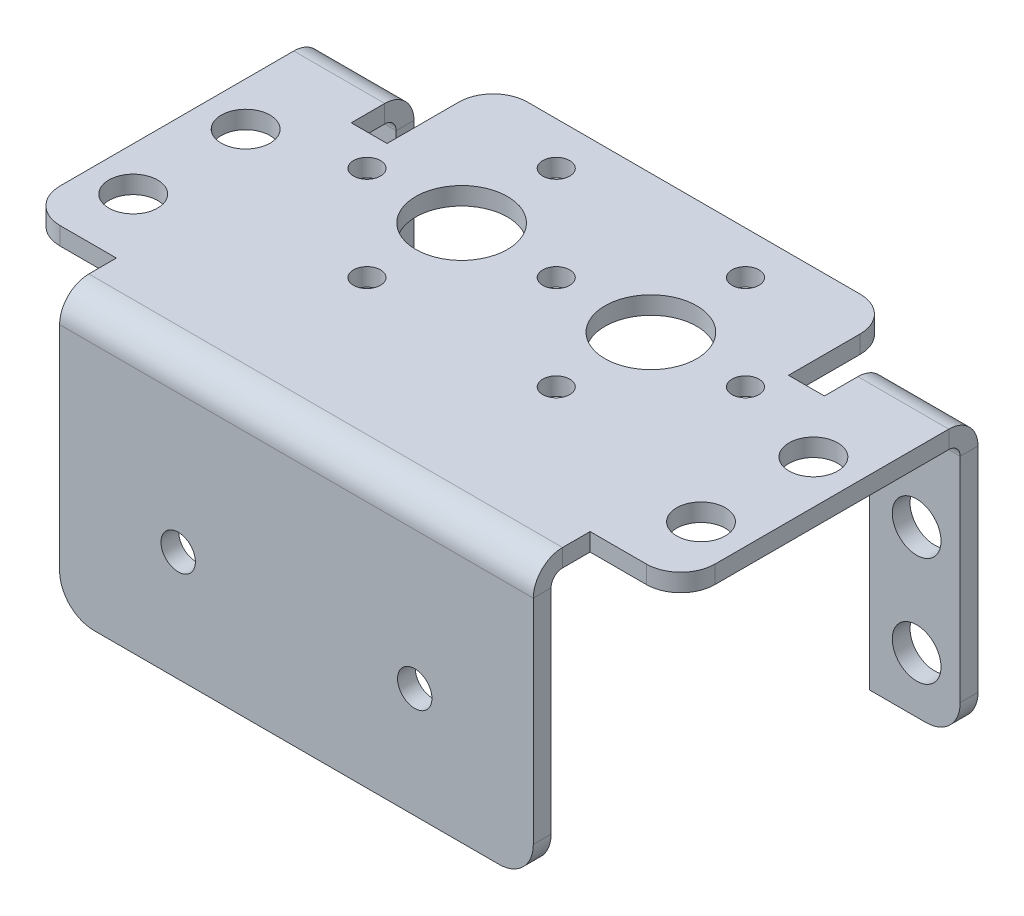
from build123d import *

# Parameters (mm, degrees)
SKETCH2_R                    = 1.175
SKETCH2_R_2                  = 4
SKETCH2_R_3                  = 2.125
BASE_FLANGE1_DEPTH           = 1.55
EDGE_FLANGE1_DEPTH           = 7.925
EDGE_FLANGE1_BEND_DEPTH      = 7.925
EDGE_FLANGE2_STRIP_W         = 8.2
EDGE_FLANGE2_STRIP_H         = 1.55
EDGE_FLANGE2_STRIP_CUT_DEPTH = 41.3
EDGE_FLANGE2_DEPTH           = 41.3
FILLET1_R                    = 3
SKETCH16_R                   = 2.125
SKETCH16_R_2                 = 1.5
CUT_EXTRUDE1_DEPTH           = 49.490018561


# Sheet-metal steps are written as plain solids
with BuildPart() as part:
    # Sketch2 → Base-Flange1 (new body)
    with BuildSketch(Plane(origin=(0, 0, 0), x_dir=(1, 0, 0), z_dir=(0, 1, 0))):
        with BuildLine():
            Line((-20.65, -16.55), (20.65, -16.55))
            Line((20.65, -16.55), (20.65, -13.15))
            Line((20.65, -13.15), (25.55, -13.15))
            ThreePointArc((25.55, -13.15), (27.671320344, -12.271320344), (28.55, -10.15))
            Line((28.55, -10.15), (28.55, 10.22))
            Line((28.55, 10.22), (20.625, 10.22))
            Line((20.625, 10.22), (20.625, 7.3))
            Line((20.625, 7.3), (17.5, 7.3))
            Line((17.5, 7.3), (17.5, 13.55))
            ThreePointArc((17.5, 13.55), (16.621320344, 15.671320344), (14.5, 16.55))
            Line((14.5, 16.55), (-14.5, 16.55))
            ThreePointArc((-14.5, 16.55), (-16.621320344, 15.671320344), (-17.5, 13.55))
            Line((-17.5, 13.55), (-17.5, 7.3))
            Line((-17.5, 7.3), (-20.625, 7.3))
            Line((-20.625, 7.3), (-20.625, 10.22))
            Line((-20.625, 10.22), (-28.55, 10.22))
            Line((-28.55, 10.22), (-28.55, -10.15))
            ThreePointArc((-28.55, -10.15), (-27.671320344, -12.271320344), (-25.55, -13.15))
            Line((-25.55, -13.15), (-20.65, -13.15))
            Line((-20.65, -13.15), (-20.65, -16.55))
        make_face()
        with Locations(Location((0, 4.55, 0), (0, 0, 270))):
            Circle(SKETCH2_R, mode=Mode.SUBTRACT)
        with Locations(Location((8.25, -3.7, 0), (0, 0, 270))):
            Circle(SKETCH2_R, mode=Mode.SUBTRACT)
        with Locations(Location((8.25, 4.55, 0), (0, 0, 270))):
            Circle(SKETCH2_R_2, mode=Mode.SUBTRACT)
        with Locations(Location((24.75, 2.22, 0), (0, 0, 270))):
            Circle(SKETCH2_R_3, mode=Mode.SUBTRACT)
        with Locations(Location((24.75, -7.58, 0), (0, 0, 270))):
            Circle(SKETCH2_R_3, mode=Mode.SUBTRACT)
        with Locations(Location((-16.5, 4.55, 0), (0, 0, 270))):
            Circle(SKETCH2_R, mode=Mode.SUBTRACT)
        with Locations(Location((-8.25, -3.7, 0), (0, 0, 270))):
            Circle(SKETCH2_R, mode=Mode.SUBTRACT)
        with Locations(Location((-24.75, -7.58, 0), (0, 0, 270))):
            Circle(SKETCH2_R_3, mode=Mode.SUBTRACT)
        with Locations(Location((-24.75, 2.22, 0), (0, 0, 270))):
            Circle(SKETCH2_R_3, mode=Mode.SUBTRACT)
        with Locations(Location((16.5, 4.55, 0), (0, 0, 270))):
            Circle(SKETCH2_R, mode=Mode.SUBTRACT)
        with Locations(Location((8.25, 12.8, 0), (0, 0, 270))):
            Circle(SKETCH2_R, mode=Mode.SUBTRACT)
        with Locations(Location((-8.25, 12.8, 0), (0, 0, 270))):
            Circle(SKETCH2_R, mode=Mode.SUBTRACT)
        with Locations(Location((-8.25, 4.55, 0), (0, 0, 270))):
            Circle(SKETCH2_R_2, mode=Mode.SUBTRACT)
    extrude(amount=-BASE_FLANGE1_DEPTH)

    # Edge-Flange1 section (across the edge) → Edge-Flange1 (add)
    with BuildSketch(Plane(origin=(-28.55, -1.55, -11.22), x_dir=(0, 0, 1), z_dir=(1, 0, 0))):
        with BuildLine():
            Line((-1.55, 1), (-1.55, 22.6))
            Line((-1.55, 22.6), (0, 22.6))
            Line((0, 22.6), (0, 1))
            ThreePointArc((0, 1), (0.292893219, 0.292893219), (1, 0))
            Line((1, 0), (1, -1.55))
            ThreePointArc((1, -1.55), (-0.803122292, -0.803122292), (-1.55, 1))
        make_face()
    extrude(amount=EDGE_FLANGE1_DEPTH)

    # Edge-Flange1 section 2 (across the edge) → Edge-Flange1 bend (add)
    with BuildSketch(Plane(origin=(20.625, -1.55, -11.22), x_dir=(0, 0, 1), z_dir=(1, 0, 0))):
        with BuildLine():
            Line((-1.55, 1), (-1.55, 22.6))
            Line((-1.55, 22.6), (0, 22.6))
            Line((0, 22.6), (0, 1))
            ThreePointArc((0, 1), (0.292893219, 0.292893219), (1, 0))
            Line((1, 0), (1, -1.55))
            ThreePointArc((1, -1.55), (-0.803122292, -0.803122292), (-1.55, 1))
        make_face()
    extrude(amount=EDGE_FLANGE1_BEND_DEPTH)

    # Edge-Flange2 strip (across the edge) → Edge-Flange2 strip cut (cut)
    with BuildSketch(Plane(origin=(20.65, -1.55, 16.55), x_dir=(0, 0, -1), z_dir=(-1, 0, 0))):
        with Locations((-3.1, -0.775)):
            Rectangle(EDGE_FLANGE2_STRIP_W, EDGE_FLANGE2_STRIP_H)
    extrude(amount=EDGE_FLANGE2_STRIP_CUT_DEPTH, mode=Mode.SUBTRACT)

    # Edge-Flange2 section (across the edge) → Edge-Flange2 (add)
    with BuildSketch(Plane(origin=(20.65, -1.55, 16.55), x_dir=(0, 0, -1), z_dir=(-1, 0, 0))):
        with BuildLine():
            Line((-1.55, 1), (-1.55, 22.6))
            Line((-1.55, 22.6), (0, 22.6))
            Line((0, 22.6), (0, 1))
            ThreePointArc((0, 1), (0.292893219, 0.292893219), (1, 0))
            Line((1, 0), (1, -1.55))
            ThreePointArc((1, -1.55), (-0.803122292, -0.803122292), (-1.55, 1))
        make_face()
    extrude(amount=EDGE_FLANGE2_DEPTH)

    # Fillet1
    fillet1_edges = [part.edges().sort_by_distance(p)[0] for p in [
        (-28.55, -24.15, -11.995),
        (28.55, -24.15, -11.995),
        (20.65, -24.15, 17.325),
        (-20.65, -24.15, 17.325),
    ]]
    fillet(fillet1_edges, radius=FILLET1_R)

    # Sketch16 → Cut-Extrude1 (cut, through all)
    with BuildSketch(Plane(origin=(0, 0, -12.77), x_dir=(-1, 0, 0), z_dir=(0, 0, -1))):
        with Locations(Location((24.75, -19.3, 0), (0, 0, 90))):
            Circle(SKETCH16_R)
        with Locations(Location((24.75, -9.8, 0), (0, 0, 90))):
            Circle(SKETCH16_R)
        with Locations(Location((10.3124, -14.55, 0), (0, 0, 90))):
            Circle(SKETCH16_R_2)
        with Locations(Location((-24.75, -9.8, 0), (0, 0, 270))):
            Circle(SKETCH16_R)
        with Locations(Location((-24.75, -19.3, 0), (0, 0, 270))):
            Circle(SKETCH16_R)
        with Locations(Location((-10.3124, -14.55, 0), (0, 0, 90))):
            Circle(SKETCH16_R_2)
    extrude(amount=-CUT_EXTRUDE1_DEPTH, mode=Mode.SUBTRACT)


solid = part.part
